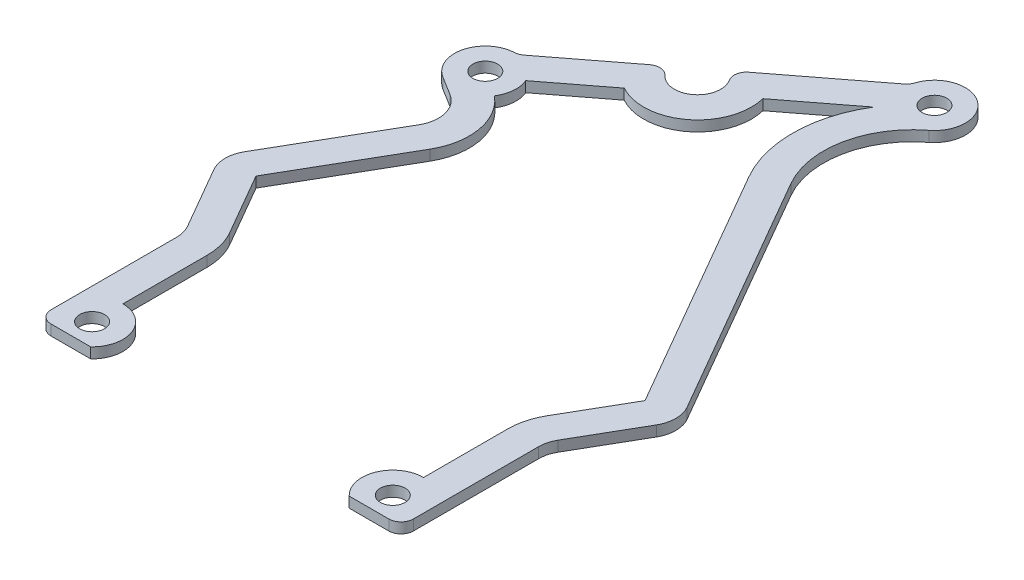
from build123d import *

# Parameters (mm, degrees)
SKETCH44_R              = 2.5527
TOP_PLATE_EXTRUDE_DEPTH = 3.175
SKETCH82_R              = 4.7625
CUT_EXTRUDE38_DEPTH     = 3.175
SKETCH72_W              = 4.7498
SKETCH72_H              = 17.4625
SKETCH72_W_2            = 49.2125
SKETCH72_H_2            = 3.0226
SKETCH72_H_3            = 18.806813894
SKETCH72_W_3            = 12.7
SKETCH72_H_4            = 9.525
BOSS_EXTRUDE27_DEPTH    = 3.175
SKETCH86_R              = 6.35
SKETCH86_R_2            = 2.5527
BOSS_EXTRUDE31_DEPTH    = 3.175
SKETCH111_W             = 17.7673
SKETCH111_H             = 10.0965
CUT_EXTRUDE57_DEPTH     = 191.266761417
SKETCH92_W              = 4.859785226
SKETCH92_H              = 15.6845
SKETCH92_W_2            = 4.8768
SKETCH92_H_2            = 22.987
SKETCH92_W_3            = 6.1468
SKETCH92_H_3            = 3.1496
SKETCH92_W_4            = 13.95095
SKETCH92_W_5            = 15.24635
CUT_EXTRUDE44_DEPTH     = 191.266761417
SKETCH95_R              = 2.5527
CUT_EXTRUDE47_DEPTH     = 25.4
SKETCH99_R              = 3.175
CUT_EXTRUDE50_DEPTH     = 191.266761417
CUT_EXTRUDE58_DEPTH     = 191.266761417
SKETCH115_W             = 1.905
SKETCH115_H             = 7.409255477
CUT_EXTRUDE60_DEPTH     = 191.266761417
FILLET5_R               = 2.54
FILLET6_R               = 2.54
FILLET7_R               = 2.54
FILLET8_R               = 1.905
SKETCH113_R             = 0.508
CUT_EXTRUDE59_DEPTH     = 191.266761558
FILLET43_R              = 0.635
FILLET43_OF_MIRROR29_R  = 0.635
BOSS_EXTRUDE32_START    = 2.159
SKETCH116_R             = 2.5527
BOSS_EXTRUDE32_DEPTH    = 3.175
CUT_EXTRUDE61_DEPTH     = 191.315032208
BOSS_EXTRUDE33_START    = 3.175
SKETCH118_R             = 2.5527
BOSS_EXTRUDE33_DEPTH    = 3.175
SKETCH119_R             = 2.5527
CUT_EXTRUDE62_DEPTH     = 191.43046765
CUT_EXTRUDE63_DEPTH     = 191.43046765
DELETEFACE1_START       = 30.734
DELETEFACE1_OUTLINE_R   = 2.5527
DELETEFACE1_DEPTH       = 3.175
CUT_EXTRUDE64_DEPTH     = 191.43046765
FILLET44_R              = 6.35
FILLET45_R              = 1.27
FILLET46_R              = 1.27
FILLET47_R              = 3.175
FILLET48_R              = 3.175
FILLET49_R              = 2.54
SKETCH122_R             = 2.5527
BOSS_EXTRUDE34_DEPTH    = 2.159


# Read off the part's stored shape, not the designer's step: DeleteFace1
with BuildPart() as part:
    # Sketch44 → Top Plate Extrude----------- (new body)
    with BuildSketch(Plane(origin=(0, 25.4, 0), x_dir=(1, 0, 0), z_dir=(0, 1, 0))):
        with BuildLine():
            Line((-104.775, -68.124686106), (-104.775, -152.527))
            Line((-104.775, -152.527), (104.775, -152.527))
            Line((104.775, -152.527), (104.775, -68.124686106))
            Line((104.775, -68.124686106), (92.075, -68.124686106))
            Line((92.075, -68.124686106), (92.075, -62.647632589))
            Line((92.075, -62.647632589), (21.81178084, -8.732768266))
            ThreePointArc((21.81178084, -8.732768266), (18.724426226, -14.191930366), (14.302849775, -18.63983673))
            Line((14.302849775, -18.63983673), (-38.049902469, -58.811516421))
            ThreePointArc((-38.049902469, -58.811516421), (-44.800532006, -62.419803084), (-52.352752243, -63.666679691))
            Line((-52.352752243, -63.666679691), (-92.075, -63.666679691))
            Line((-92.075, -63.666679691), (-92.075, -68.124686106))
            Line((-92.075, -68.124686106), (-104.775, -68.124686106))
        make_face()
        with Locations(Location((-73.83145, -147.7645, 0), (0, 0, 90))):
            Circle(SKETCH44_R, mode=Mode.SUBTRACT)
        with Locations(Location((-59.54395, -147.7645, 0), (0, 0, 90))):
            Circle(SKETCH44_R, mode=Mode.SUBTRACT)
        with Locations(Location((-45.25645, -147.7645, 0), (0, 0, 90))):
            Circle(SKETCH44_R, mode=Mode.SUBTRACT)
        with Locations(Location((-30.96895, -147.7645, 0), (0, 0, 90))):
            Circle(SKETCH44_R, mode=Mode.SUBTRACT)
        with Locations(Location((-100.0125, -99.6315, 0), (0, 0, 270))):
            Circle(SKETCH44_R, mode=Mode.SUBTRACT)
        with Locations(Location((-100.0125, -147.7645, 0), (0, 0, 270))):
            Circle(SKETCH44_R, mode=Mode.SUBTRACT)
        with Locations(Location((100.0125, -147.7645, 0), (0, 0, 90))):
            Circle(SKETCH44_R, mode=Mode.SUBTRACT)
        with Locations(Location((100.0125, -99.6315, 0), (0, 0, 90))):
            Circle(SKETCH44_R, mode=Mode.SUBTRACT)
        with Locations(Location((30.96895, -147.7645, 0), (0, 0, 270))):
            Circle(SKETCH44_R, mode=Mode.SUBTRACT)
        with Locations(Location((45.25645, -147.7645, 0), (0, 0, 270))):
            Circle(SKETCH44_R, mode=Mode.SUBTRACT)
        with Locations(Location((59.54395, -147.7645, 0), (0, 0, 270))):
            Circle(SKETCH44_R, mode=Mode.SUBTRACT)
        with Locations(Location((73.83145, -147.7645, 0), (0, 0, 270))):
            Circle(SKETCH44_R, mode=Mode.SUBTRACT)
        with Locations(Location((-87.3125, -68.429179691, 0), (0, 0, 270))):
            Circle(SKETCH44_R, mode=Mode.SUBTRACT)
        with Locations(Location((-35.150676163, -62.589861704, 0), (0, 0, 270))):
            Circle(SKETCH44_R, mode=Mode.SUBTRACT)
        with Locations(Location((17.20207608, -22.418182013, 0), (0, 0, 270))):
            Circle(SKETCH44_R, mode=Mode.SUBTRACT)
        with Locations(Location((45.531325629, -32.936414996, 0), (0, 0, 270))):
            Circle(SKETCH44_R, mode=Mode.SUBTRACT)
        with Locations(Location((87.3125, -64.996237681, 0), (0, 0, 270))):
            Circle(SKETCH44_R, mode=Mode.SUBTRACT)
        with Locations(Location((-97.155, -85.269686106, 0), (0, 0, 270))):
            Circle(SKETCH44_R, mode=Mode.SUBTRACT)
        with Locations(Location((24.42940612, -36.754342231, 0), (0, 0, 270))):
            Circle(SKETCH44_R, mode=Mode.SUBTRACT)
        with Locations(Location((97.155, -85.269686106, 0), (0, 0, 270))):
            Circle(SKETCH44_R, mode=Mode.SUBTRACT)
    extrude(amount=TOP_PLATE_EXTRUDE_DEPTH)

    # Sketch82 → Cut-Extrude38 (cut)
    with BuildSketch(Plane(origin=(0, 28.575, 0), x_dir=(1, 0, 0), z_dir=(0, 1, 0))):
        with Locations((-52.352752243, -65.571679691)):
            Circle(SKETCH82_R)
        with Locations((-12.44667807, -41.56667131)):
            Circle(SKETCH82_R)
        with Locations((58.296246284, -39.129483192)):
            Circle(SKETCH82_R)
        with BuildLine():
            Line((21.464274093, -9.555101394), (21.81178084, -8.732768266))
            Line((21.81178084, -8.732768266), (22.214272521, -9.041610995))
            ThreePointArc((22.214272521, -9.041610995), (27.20799018, -17.139845005), (21.464274093, -9.555101394))
        make_face()
    extrude(amount=-CUT_EXTRUDE38_DEPTH, mode=Mode.SUBTRACT)

    # Sketch72 → Boss-Extrude27 (add, through all)
    with BuildSketch(Plane(origin=(0, 25.4, 0), x_dir=(1, 0, 0), z_dir=(0, 1, 0))):
        with Locations((-107.1499, -143.79575)):
            Rectangle(SKETCH72_W, SKETCH72_H)
        with Locations((-52.4002, -154.0383)):
            Rectangle(SKETCH72_W_2, SKETCH72_H_2)
        with Locations((-107.1499, -102.928093053)):
            Rectangle(SKETCH72_W, SKETCH72_H_3)
        with Locations((-6.35, -154.0383)):
            Rectangle(SKETCH72_W_3, SKETCH72_H_2)
        with Locations((-107.1499, -72.887186106)):
            Rectangle(SKETCH72_W, SKETCH72_H_4)
        with Locations((-97.155, -154.0383)):
            Rectangle(SKETCH72_W_3, SKETCH72_H_2)
    boss_extrude27 = extrude(amount=BOSS_EXTRUDE27_DEPTH)

    # Mirror22: Boss-Extrude27 across plane
    add(boss_extrude27.mirror(Plane(origin=(0, 0, 0), x_dir=(0, 0, 1), z_dir=(1, 0, 0))))

    # Sketch86 → Boss-Extrude31 (add, through all)
    # profile 1 of 5: a face of its own
    with BuildSketch(Plane(origin=(0, 28.575, 0), x_dir=(1, 0, 0), z_dir=(0, 1, 0))):
        with Locations((87.3125, -64.996237681)):
            Circle(SKETCH86_R)
        with Locations(Location((87.3125, -64.996237681, 0), (0, 0, 270))):
            Circle(SKETCH86_R_2, mode=Mode.SUBTRACT)
    # profile 2 of 5: a face of its own
    with BuildSketch(Plane(origin=(0, 28.575, 0), x_dir=(1, 0, 0), z_dir=(0, 1, 0))):
        with Locations((17.20207608, -22.418182013)):
            Circle(SKETCH86_R)
        with Locations(Location((17.20207608, -22.418182013, 0), (0, 0, 270))):
            Circle(SKETCH86_R_2, mode=Mode.SUBTRACT)
    # profile 3 of 5: a face of its own
    with BuildSketch(Plane(origin=(0, 28.575, 0), x_dir=(1, 0, 0), z_dir=(0, 1, 0))):
        with Locations((45.531325629, -32.936414996)):
            Circle(SKETCH86_R)
        with Locations(Location((45.531325629, -32.936414996, 0), (0, 0, 270))):
            Circle(SKETCH86_R_2, mode=Mode.SUBTRACT)
    # profile 4 of 5: a face of its own
    with BuildSketch(Plane(origin=(0, 28.575, 0), x_dir=(1, 0, 0), z_dir=(0, 1, 0))):
        with Locations((-35.150676163, -62.589861704)):
            Circle(SKETCH86_R)
        with Locations(Location((-35.150676163, -62.589861704, 0), (0, 0, 270))):
            Circle(SKETCH86_R_2, mode=Mode.SUBTRACT)
    # profile 5 of 5: a face of its own
    with BuildSketch(Plane(origin=(0, 28.575, 0), x_dir=(1, 0, 0), z_dir=(0, 1, 0))):
        with Locations((-87.3125, -68.429179691)):
            Circle(SKETCH86_R)
        with Locations(Location((-87.3125, -68.429179691, 0), (0, 0, 270))):
            Circle(SKETCH86_R_2, mode=Mode.SUBTRACT)
    extrude(amount=-BOSS_EXTRUDE31_DEPTH)

    # Sketch111 → Cut-Extrude57 (cut, through all)
    with BuildSketch(Plane(origin=(0, 28.575, 0), x_dir=(1, 0, 0), z_dir=(0, 1, 0))):
        with Locations((-100.64115, -72.918936106)):
            Rectangle(SKETCH111_W, SKETCH111_H)
        with Locations((100.64115, -72.918936106)):
            Rectangle(SKETCH111_W, SKETCH111_H)
    extrude(amount=-CUT_EXTRUDE57_DEPTH, mode=Mode.SUBTRACT)

    # Sketch92 → Cut-Extrude44 (cut, through all)
    with BuildSketch(Plane(origin=(0, 28.575, 0), x_dir=(1, 0, 0), z_dir=(0, 1, 0))):
        with Locations((-107.094907387, -85.809436106)):
            Rectangle(SKETCH92_W, SKETCH92_H)
        with Locations((-107.0864, -123.698)):
            Rectangle(SKETCH92_W_2, SKETCH92_H_2)
        with Locations((-106.4514, -153.9748)):
            Rectangle(SKETCH92_W_3, SKETCH92_H_3)
        with Locations((-83.905725, -153.9748)):
            Rectangle(SKETCH92_W_4, SKETCH92_H_3)
        with Locations((-20.246975, -153.9748)):
            Rectangle(SKETCH92_W_5, SKETCH92_H_3)
    cut_extrude44 = extrude(amount=-CUT_EXTRUDE44_DEPTH, mode=Mode.SUBTRACT)

    # Mirror26: Cut-Extrude44 across plane
    add(cut_extrude44.mirror(Plane(origin=(0, 0, 0), x_dir=(0, 0, 1), z_dir=(1, 0, 0))), mode=Mode.SUBTRACT)

    # Sketch95 → Cut-Extrude47 (cut)
    with BuildSketch(Plane(origin=(0, 28.575, 0), x_dir=(1, 0, 0), z_dir=(0, 1, 0))):
        with BuildLine():
            Line((-14.966768676, -141.097), (14.966768676, -141.097))
            ThreePointArc((14.966768676, -141.097), (18.013644543, -132.45695017), (26.522246674, -135.853654954))
            Line((26.522246674, -135.853654954), (44.392192993, -104.902))
            Line((44.392192993, -104.902), (26.522246674, -73.950345046))
            ThreePointArc((26.522246674, -73.950345046), (18.013644543, -77.34704983), (14.966768676, -68.707))
            Line((14.966768676, -68.707), (-14.966768676, -68.707))
            ThreePointArc((-14.966768676, -68.707), (-18.013644543, -77.34704983), (-26.522246674, -73.950345046))
            Line((-26.522246674, -73.950345046), (-44.392192993, -104.902))
            Line((-44.392192993, -104.902), (-26.522246674, -135.853654954))
            ThreePointArc((-26.522246674, -135.853654954), (-18.013644543, -132.45695017), (-14.966768676, -141.097))
        make_face()
        with Locations(Location((-20.6375, -71.5645, 0), (0, 0, 270))):
            Circle(SKETCH95_R)
        with Locations(Location((20.6375, -71.5645, 0), (0, 0, 270))):
            Circle(SKETCH95_R)
        with Locations(Location((20.6375, -138.2395, 0), (0, 0, 270))):
            Circle(SKETCH95_R)
        with Locations(Location((-20.6375, -138.2395, 0), (0, 0, 270))):
            Circle(SKETCH95_R)
    extrude(amount=-CUT_EXTRUDE47_DEPTH, mode=Mode.SUBTRACT)

    # Sketch99 → Cut-Extrude50 (cut, through all)
    with BuildSketch(Plane(origin=(0, 28.575, 0), x_dir=(1, 0, 0), z_dir=(0, 1, 0))):
        with Locations(Location((-1.83388, -60.19546, 0), (0, 0, 270))):
            Circle(SKETCH99_R)
    extrude(amount=-CUT_EXTRUDE50_DEPTH, mode=Mode.SUBTRACT)

    # Sketch112 → Cut-Extrude58 (cut, through all)
    with BuildSketch(Plane(origin=(0, 28.575, 0), x_dir=(1, 0, 0), z_dir=(0, 1, 0))):
        Polygon((-26.522246674, -135.853654954), (-24.61895, -139.150261495), (-24.61895, -152.4), (-24.61895, -155.5496), (24.61895, -155.5496), (24.61895, -152.4), (24.61895, -139.150261495), (26.522246674, -135.853654954), (26.522246674, -131.8895), (-26.522246674, -131.8895), align=None)
    extrude(amount=-CUT_EXTRUDE58_DEPTH, mode=Mode.SUBTRACT)

    # Sketch115 → Cut-Extrude60 (cut, through all)
    with BuildSketch(Plane(origin=(0, 28.575, 0), x_dir=(1, 0, 0), z_dir=(0, 1, 0))):
        with BuildLine():
            Line((-91.7575, -67.870686106), (-93.637892076, -67.870686106))
            Line((-93.637892076, -67.870686106), (-93.637892076, -63.666679691))
            Line((-93.637892076, -63.666679691), (-91.7575, -63.666679691))
            Line((-91.7575, -63.666679691), (-91.512630206, -63.666679691))
            ThreePointArc((-91.512630206, -63.666679691), (-91.636564071, -63.778914117), (-91.7575, -63.894372639))
            Line((-91.7575, -63.894372639), (-91.7575, -67.870686106))
        make_face()
        with Locations((92.71, -64.166058367)):
            Rectangle(SKETCH115_W, SKETCH115_H)
    extrude(amount=-CUT_EXTRUDE60_DEPTH, mode=Mode.SUBTRACT)

    # Fillet5
    fillet5_edges = [part.edges().sort_by_distance(p)[0] for p in [
        (-44.392192993, 26.9875, 104.902),
        (-26.522246674, 26.9875, 73.950345046),
        (-14.966768676, 26.9875, 68.707),
        (14.966768676, 26.9875, 68.707),
        (26.522246674, 26.9875, 73.950345046),
        (44.392192993, 26.9875, 104.902),
        (24.61895, 26.9875, 139.150261495),
        (-24.61895, 26.9875, 139.150261495),
    ]]
    fillet(fillet5_edges, radius=FILLET5_R)

    # Fillet6
    fillet6_edges = [part.edges().sort_by_distance(p)[0] for p in [
        (-91.7575, 26.9875, 63.894372639),
        (91.7575, 26.9875, 60.461430629),
    ]]
    fillet(fillet6_edges, radius=FILLET6_R)

    # Fillet7
    fillet7_edges = [part.edges().sort_by_distance(p)[0] for p in [
        (-56.717655593, 26.9875, 63.666679691),
        (-17.069279245, 26.9875, 42.712517997),
        (-10.14345794, 26.9875, 37.398148396),
        (55.993026154, 26.9875, 34.960960278),
        (62.918847459, 26.9875, 40.275329879),
        (-48.171509306, 26.9875, 63.291632816),
        (29.140093826, 26.9875, 14.355980596),
        (86.879538977, 26.9875, 58.661015131),
        (17.141153982, 26.9875, 16.068474264),
        (10.970662446, 26.9875, 21.196713997),
        (51.762739264, 26.9875, 31.71494698),
        (45.098364606, 26.9875, 26.601192447),
        (-41.268255068, 26.9875, 60.88759018),
        (-34.71771514, 26.9875, 56.254639155),
        (-83.112369794, 26.9875, 63.666679691),
        (-104.665014774, 26.9875, 77.967186106),
        (104.665014774, 26.9875, 77.967186106),
    ]]
    fillet(fillet7_edges, radius=FILLET7_R)

    # Fillet8
    fillet8_edges = [part.edges().sort_by_distance(p)[0] for p in [
        (19.785658887, 26.9875, 12.670545663),
    ]]
    fillet(fillet8_edges, radius=FILLET8_R)

    # Sketch113 → Cut-Extrude59 (cut, through all)
    with BuildSketch(Plane(origin=(0, 28.575, 0), x_dir=(1, 0, 0), z_dir=(0, 1, 0))):
        with Locations((-91.7575, -77.967186106)):
            Circle(SKETCH113_R)
        with Locations((-104.665014774, -93.651686106)):
            Circle(SKETCH113_R)
        with Locations((-104.648, -112.2045)):
            Circle(SKETCH113_R)
        with Locations((-104.648, -135.1915)):
            Circle(SKETCH113_R)
        with Locations((-103.378, -152.4)):
            Circle(SKETCH113_R)
        with Locations((-90.8812, -152.4)):
            Circle(SKETCH113_R)
        with Locations((-76.93025, -152.4)):
            Circle(SKETCH113_R)
        with Locations((-27.87015, -152.4)):
            Circle(SKETCH113_R)
    cut_extrude59 = extrude(amount=-CUT_EXTRUDE59_DEPTH, mode=Mode.SUBTRACT)

    # Fillet43
    fillet43_edges = [part.edges().sort_by_distance(p)[0] for p in [
        (-103.886, 26.9875, 152.4),
        (-76.93025, 26.9875, 152.908),
        (-90.3732, 26.9875, 152.4),
        (-105.156, 26.9875, 135.1915),
        (-104.648, 26.9875, 112.7125),
        (-27.36215, 26.9875, 152.4),
        (-105.173014774, 26.9875, 93.651686106),
        (-91.7575, 26.9875, 77.459186106),
        (-92.2655, 26.9875, 77.967186106),
        (-104.665014774, 26.9875, 93.143686106),
        (-105.156, 26.9875, 112.2045),
        (-104.648, 26.9875, 134.6835),
        (-103.378, 26.9875, 152.908),
        (-90.8812, 26.9875, 152.908),
        (-77.43825, 26.9875, 152.4),
        (-27.87015, 26.9875, 152.908),
    ]]
    fillet(fillet43_edges, radius=FILLET43_R)

    # Mirror29: Cut-Extrude59 across plane
    add(cut_extrude59.mirror(Plane(origin=(0, 0, 0), x_dir=(0, 0, 1), z_dir=(1, 0, 0))), mode=Mode.SUBTRACT)

    # Fillet43 of Mirror29
    fillet43_of_mirror29_edges = [part.edges().sort_by_distance(p)[0] for p in [
        (103.886, 26.9875, 152.4),
        (76.93025, 26.9875, 152.908),
        (90.3732, 26.9875, 152.4),
        (105.156, 26.9875, 135.1915),
        (104.648, 26.9875, 112.7125),
        (27.36215, 26.9875, 152.4),
        (105.173014774, 26.9875, 93.651686106),
        (91.7575, 26.9875, 77.459186106),
        (92.2655, 26.9875, 77.967186106),
        (104.665014774, 26.9875, 93.143686106),
        (105.156, 26.9875, 112.2045),
        (104.648, 26.9875, 134.6835),
        (103.378, 26.9875, 152.908),
        (90.8812, 26.9875, 152.908),
        (77.43825, 26.9875, 152.4),
        (27.87015, 26.9875, 152.908),
    ]]
    fillet(fillet43_of_mirror29_edges, radius=FILLET43_OF_MIRROR29_R)

    # Sketch117 → Cut-Extrude61 (cut, through all)
    with BuildSketch(Plane(origin=(0, 28.575, 0), x_dir=(1, 0, 0), z_dir=(0, 1, 0))):
        with BuildLine():
            Line((26.828159473, -37.627417051), (25.525062727, -41.207645937))
            ThreePointArc((25.525062727, -41.207645937), (22.253234554, -42.73332447), (20.727556021, -39.461496297))
            Line((20.727556021, -39.461496297), (22.030652767, -35.881267412))
            ThreePointArc((22.030652767, -35.881267412), (25.30248094, -34.355588878), (26.828159473, -37.627417051))
        make_face()
        with BuildLine():
            Line((1.34112, -60.19546), (1.34112, -61.78296))
            ThreePointArc((1.34112, -61.78296), (-1.83388, -64.95796), (-5.00888, -61.78296))
            Line((-5.00888, -61.78296), (-5.00888, -60.19546))
            ThreePointArc((-5.00888, -60.19546), (-1.83388, -57.02046), (1.34112, -60.19546))
        make_face()
    extrude(amount=-CUT_EXTRUDE61_DEPTH, mode=Mode.SUBTRACT)

    # Sketch119 → Cut-Extrude62 (cut, through all)
    with BuildSketch(Plane.XZ.offset(-25.4)):
        with BuildLine():
            ThreePointArc((-24.618334265, 76.511767787), (-26.67742503, 75.993929451), (-28.410372496, 77.220674902))
            Line((-28.410372496, 77.220674902), (-28.410372496, 59.418844751))
            Line((-28.410372496, 59.418844751), (-16.707657981, 50.439036071))
            ThreePointArc((-16.707657981, 50.439036071), (-6.454943705, 49.375251561), (-2.773809056, 39.747217744))
            Line((-2.773809056, 39.747217744), (3.843489743, 34.669585789))
            Line((3.843489743, 34.669585789), (28.410372496, 77.220674902))
            ThreePointArc((28.410372496, 77.220674902), (26.67742503, 75.993929451), (24.618334265, 76.511767787))
            ThreePointArc((24.618334265, 76.511767787), (17.793005442, 77.24176613), (14.291551037, 71.337714286))
            ThreePointArc((14.291551037, 71.337714286), (13.581013661, 69.48331271), (11.753171452, 68.707))
            Line((11.753171452, 68.707), (-11.753171452, 68.707))
            ThreePointArc((-11.753171452, 68.707), (-13.581013661, 69.48331271), (-14.291551037, 71.337714286))
            ThreePointArc((-14.291551037, 71.337714286), (-17.793005442, 77.24176613), (-24.618334265, 76.511767787))
        make_face()
        with BuildLine():
            Line((1.34112, 61.78296), (1.34112, 60.19546))
            ThreePointArc((1.34112, 60.19546), (-1.83388, 57.02046), (-5.00888, 60.19546))
            Line((-5.00888, 60.19546), (-5.00888, 61.78296))
            ThreePointArc((-5.00888, 61.78296), (-1.83388, 64.95796), (1.34112, 61.78296))
        make_face(mode=Mode.SUBTRACT)
        with Locations(Location((-20.6375, 71.5645, 0), (0, 0, 90))):
            Circle(SKETCH119_R, mode=Mode.SUBTRACT)
        with Locations(Location((20.6375, 71.5645, 0), (0, 0, 90))):
            Circle(SKETCH119_R, mode=Mode.SUBTRACT)
    extrude(amount=-CUT_EXTRUDE62_DEPTH, mode=Mode.SUBTRACT)

    # Sketch120 → Cut-Extrude63 (cut, through all)
    with BuildSketch(Plane.XZ.offset(-25.4)):
        with BuildLine():
            Line((-10.217726595, 45.775374384), (-7.104183749, 49.83302242))
            ThreePointArc((-7.104183749, 49.83302242), (-6.454943705, 49.375251561), (-5.844735322, 48.866613652))
            Line((-5.844735322, 48.866613652), (-8.958278167, 44.808965616))
            ThreePointArc((-8.958278167, 44.808965616), (-9.547451764, 45.345016593), (-10.217726595, 45.775374384))
        make_face()
    extrude(amount=-CUT_EXTRUDE63_DEPTH, mode=Mode.SUBTRACT)


with BuildPart() as body_2:
    # Sketch116 → Boss-Extrude32 (new body)
    with BuildSketch(Plane(origin=(0, 28.575, 0), x_dir=(1, 0, 0), z_dir=(0, 1, 0)).offset(BOSS_EXTRUDE32_START)):
        Polygon((-25.4, -66.802), (25.4, -66.802), (47.397045256, -104.902), (37.31895, -122.357773027), (37.31895, -143.002), (37.31895, -152.4), (12.4206, -152.4), (12.4206, -155.5496), (-12.4206, -155.5496), (-12.4206, -152.4), (-37.31895, -152.4), (-37.31895, -143.002), (-37.31895, -122.357773027), (-47.397045256, -104.902), align=None)
        with Locations(Location((30.96895, -147.7645, 0), (0, 0, 270))):
            Circle(SKETCH116_R, mode=Mode.SUBTRACT)
        with Locations(Location((-30.96895, -147.7645, 0), (0, 0, 90))):
            Circle(SKETCH116_R, mode=Mode.SUBTRACT)
        with Locations(Location((20.6375, -71.5645, 0), (0, 0, 270))):
            Circle(SKETCH116_R, mode=Mode.SUBTRACT)
        with Locations(Location((-20.6375, -71.5645, 0), (0, 0, 270))):
            Circle(SKETCH116_R, mode=Mode.SUBTRACT)
    extrude(amount=BOSS_EXTRUDE32_DEPTH)

    # Sketch118 → Boss-Extrude33 (add)
    with BuildSketch(Plane(origin=(0, 30.734, 0), x_dir=(1, 0, 0), z_dir=(0, 1, 0)).offset(BOSS_EXTRUDE33_START)):
        with BuildLine():
            Line((10.280494061, -21.726298825), (-7.834850838, -35.626691862))
            ThreePointArc((-7.834850838, -35.626691862), (-8.790052591, -37.200993094), (-8.430538117, -39.006978725))
            ThreePointArc((-8.430538117, -39.006978725), (-9.547451764, -45.345016593), (-15.958604753, -44.783467422))
            ThreePointArc((-15.958604753, -44.783467422), (-17.610003723, -43.96877963), (-19.377886346, -44.483974531))
            Line((-19.377886346, -44.483974531), (-34.027546755, -55.725054327))
            ThreePointArc((-34.027546755, -55.725054327), (-34.700321183, -56.095022456), (-35.452908035, -56.247058232))
            ThreePointArc((-35.452908035, -56.247058232), (-41.29836226, -60.999749867), (-38.49041558, -67.990661703))
            Line((-38.49041558, -67.990661703), (-29.3497017, -73.64308402))
            Line((-29.3497017, -73.64308402), (-25.4, -66.802))
            Line((-25.4, -66.802), (25.4, -66.802))
            Line((25.4, -66.802), (16.356889842, -51.138873748))
            ThreePointArc((16.356889842, -51.138873748), (14.255494678, -38.410910939), (21.067711154, -27.455975724))
            ThreePointArc((21.067711154, -27.455975724), (20.854631298, -17.223825423), (11.153621759, -20.484610104))
            ThreePointArc((11.153621759, -20.484610104), (10.811982667, -21.172203427), (10.280494061, -21.726298825))
        make_face()
        with Locations(Location((17.20207608, -22.418182013, 0), (0, 0, 270))):
            Circle(SKETCH118_R, mode=Mode.SUBTRACT)
        with Locations(Location((-35.150676163, -62.589861704, 0), (0, 0, 270))):
            Circle(SKETCH118_R, mode=Mode.SUBTRACT)
        with BuildLine():
            Line((-5.00888, -60.19546), (-5.00888, -61.78296))
            ThreePointArc((-5.00888, -61.78296), (-1.83388, -64.95796), (1.34112, -61.78296))
            Line((1.34112, -61.78296), (1.34112, -60.19546))
            ThreePointArc((1.34112, -60.19546), (-1.83388, -57.02046), (-5.00888, -60.19546))
        make_face(mode=Mode.SUBTRACT)
    extrude(amount=-BOSS_EXTRUDE33_DEPTH)

    # DeleteFace1 outline → DeleteFace1 (add)
    with BuildSketch(Plane(origin=(0, 0, 0), x_dir=(1, 0, 0), z_dir=(0, 1, 0)).offset(DELETEFACE1_START)):
        with Locations((20.6375, -71.5645)):
            Circle(DELETEFACE1_OUTLINE_R)
        with Locations((-20.6375, -71.5645)):
            Circle(DELETEFACE1_OUTLINE_R)
    extrude(amount=DELETEFACE1_DEPTH)

    # Fillet44
    fillet44_edges = [body_2.edges().sort_by_distance(p)[0] for p in [
        (47.397045256, 32.3215, 104.902),
        (37.31895, 32.3215, 122.357773027),
        (-37.31895, 32.3215, 122.357773027),
        (-47.397045256, 32.3215, 104.902),
        (-29.3497017, 32.3215, 73.64308402),
    ]]
    fillet(fillet44_edges, radius=FILLET44_R)

    # Fillet49
    fillet49_edges = [body_2.edges().sort_by_distance(p)[0] for p in [
        (37.31895, 32.3215, 152.4),
        (-37.31895, 32.3215, 152.4),
    ]]
    fillet(fillet49_edges, radius=FILLET49_R)


with BuildPart() as cut_extrude63_piece_1:
    # of the separate pieces the step leaves, piece 1, a body of its own (cut_extrude63_pieces)
    add(part.part.solids().sort_by_distance((26.919769024, 25.4, 152.4))[0])

    # Fillet46
    fillet46_edges = [cut_extrude63_piece_1.edges().sort_by_distance(p)[0] for p in [
        (-5.844735322, 26.9875, 48.866613652),
        (-8.958278167, 26.9875, 44.808965616),
    ]]
    fillet(fillet46_edges, radius=FILLET46_R)

    # Fillet48
    fillet48_edges = [cut_extrude63_piece_1.edges().sort_by_distance(p)[0] for p in [
        (3.843489743, 26.9875, 34.669585789),
        (-2.773809056, 26.9875, 39.747217744),
    ]]
    fillet(fillet48_edges, radius=FILLET48_R)


with BuildPart() as cut_extrude63_piece_2:
    # of the separate pieces the step leaves, piece 2, a body of its own (cut_extrude63_pieces)
    add(part.part.solids().sort_by_distance((-16.707657981, 25.4, 50.439036071))[0])

    # Sketch121 → Cut-Extrude64 (cut, through all)
    with BuildSketch(Plane.XZ.offset(-25.4)):
        with BuildLine():
            Line((-28.719749725, 51.652238419), (-24.854114651, 56.69003213))
            Line((-24.854114651, 56.69003213), (-16.707657981, 50.439036071))
            ThreePointArc((-16.707657981, 50.439036071), (-11.826813979, 51.389632918), (-7.104183749, 49.83302242))
            Line((-7.104183749, 49.83302242), (-10.217726595, 45.775374384))
            ThreePointArc((-10.217726595, 45.775374384), (-13.257527132, 46.259637328), (-15.958604753, 44.783467422))
            ThreePointArc((-15.958604753, 44.783467422), (-17.610003723, 43.96877963), (-19.377886346, 44.483974531))
            Line((-19.377886346, 44.483974531), (-28.719749725, 51.652238419))
        make_face()
    extrude(amount=-CUT_EXTRUDE64_DEPTH, mode=Mode.SUBTRACT)

    # Fillet45
    fillet45_edges = [cut_extrude63_piece_2.edges().sort_by_distance(p)[0] for p in [
        (-24.854114651, 26.9875, 56.69003213),
        (-28.719749725, 26.9875, 51.652238419),
    ]]
    fillet(fillet45_edges, radius=FILLET45_R)

    # Fillet47
    fillet47_edges = [cut_extrude63_piece_2.edges().sort_by_distance(p)[0] for p in [
        (-28.410372496, 26.9875, 77.220674902),
        (-28.410372496, 26.9875, 59.418844751),
    ]]
    fillet(fillet47_edges, radius=FILLET47_R)


with BuildPart() as body_4:
    # Sketch122 → Boss-Extrude34 (new body)
    with BuildSketch(Plane(origin=(0, 28.575, 0), x_dir=(1, 0, 0), z_dir=(0, 1, 0))):
        with BuildLine():
            Line((32.670427372, -117.709250399), (40.064696837, -104.902))
            Line((40.064696837, -104.902), (10.857628528, -54.313873748))
            ThreePointArc((10.857628528, -54.313873748), (7.556793363, -41.589482586), (11.262241834, -28.976977092))
            Line((11.262241834, -28.976977092), (-1.660608663, -38.893029039))
            ThreePointArc((-1.660608663, -38.893029039), (-5.68181669, -50.382810304), (-17.820858374, -51.293224775))
            Line((-17.820858374, -51.293224775), (-29.306444608, -60.106425066))
            ThreePointArc((-29.306444608, -60.106425066), (-28.823969902, -63.133265681), (-29.815524153, -66.033501209))
            ThreePointArc((-29.815524153, -66.033501209), (-25.428001423, -73.566513401), (-26.930897762, -82.153592705))
            Line((-26.930897762, -82.153592705), (-40.064696837, -104.902))
            Line((-40.064696837, -104.902), (-32.670427372, -117.709250399))
            ThreePointArc((-32.670427372, -117.709250399), (-31.401692006, -120.772248526), (-30.96895, -124.059250399))
            Line((-30.96895, -124.059250399), (-30.96895, -141.4145))
            ThreePointArc((-30.96895, -141.4145), (-25.063108612, -145.43136102), (-26.629060629, -152.4))
            Line((-26.629060629, -152.4), (-34.77895, -152.4))
            ThreePointArc((-34.77895, -152.4), (-36.575001224, -151.656051224), (-37.31895, -149.86))
            Line((-37.31895, -149.86), (-37.31895, -124.059250399))
            ThreePointArc((-37.31895, -124.059250399), (-37.535321003, -122.415749463), (-38.169688686, -120.884250399))
            Line((-38.169688686, -120.884250399), (-45.563958151, -108.077))
            ThreePointArc((-45.563958151, -108.077), (-46.414696837, -104.902), (-45.563958151, -101.727))
            Line((-45.563958151, -101.727), (-32.430159076, -78.978592705))
            ThreePointArc((-32.430159076, -78.978592705), (-31.771655383, -74.252970213), (-34.589680973, -70.402792707))
            Line((-34.589680973, -70.402792707), (-38.49041558, -67.990661703))
            ThreePointArc((-38.49041558, -67.990661703), (-41.29836226, -60.999749867), (-35.452908035, -56.247058232))
            ThreePointArc((-35.452908035, -56.247058232), (-34.700321183, -56.095022456), (-34.027546755, -55.725054327))
            Line((-34.027546755, -55.725054327), (-19.377886346, -44.483974531))
            ThreePointArc((-19.377886346, -44.483974531), (-17.610003723, -43.96877963), (-15.958604753, -44.783467422))
            ThreePointArc((-15.958604753, -44.783467422), (-9.547451764, -45.345016593), (-8.430538117, -39.006978725))
            ThreePointArc((-8.430538117, -39.006978725), (-8.790052591, -37.200993094), (-7.834850838, -35.626691862))
            Line((-7.834850838, -35.626691862), (10.280494061, -21.726298825))
            ThreePointArc((10.280494061, -21.726298825), (10.811982667, -21.172203427), (11.153621759, -20.484610104))
            ThreePointArc((11.153621759, -20.484610104), (20.854631298, -17.223825423), (21.067711154, -27.455975724))
            ThreePointArc((21.067711154, -27.455975724), (14.255494678, -38.410910939), (16.356889842, -51.138873748))
            Line((16.356889842, -51.138873748), (45.563958151, -101.727))
            ThreePointArc((45.563958151, -101.727), (46.414696837, -104.902), (45.563958151, -108.077))
            Line((45.563958151, -108.077), (38.169688686, -120.884250399))
            ThreePointArc((38.169688686, -120.884250399), (37.535321003, -122.415749463), (37.31895, -124.059250399))
            Line((37.31895, -124.059250399), (37.31895, -149.86))
            ThreePointArc((37.31895, -149.86), (36.575001224, -151.656051224), (34.77895, -152.4))
            Line((34.77895, -152.4), (26.629060629, -152.4))
            ThreePointArc((26.629060629, -152.4), (25.063108612, -145.43136102), (30.96895, -141.4145))
            Line((30.96895, -141.4145), (30.96895, -124.059250399))
            ThreePointArc((30.96895, -124.059250399), (31.401692006, -120.772248526), (32.670427372, -117.709250399))
        make_face()
        with Locations(Location((17.20207608, -22.418182013, 0), (0, 0, 90))):
            Circle(SKETCH122_R, mode=Mode.SUBTRACT)
        with Locations(Location((-35.150676163, -62.589861704, 0), (0, 0, 90))):
            Circle(SKETCH122_R, mode=Mode.SUBTRACT)
        with Locations(Location((-30.96895, -147.7645, 0), (0, 0, 90))):
            Circle(SKETCH122_R, mode=Mode.SUBTRACT)
        with Locations(Location((30.96895, -147.7645, 0), (0, 0, 90))):
            Circle(SKETCH122_R, mode=Mode.SUBTRACT)
    extrude(amount=BOSS_EXTRUDE34_DEPTH)


solid = body_4.part
